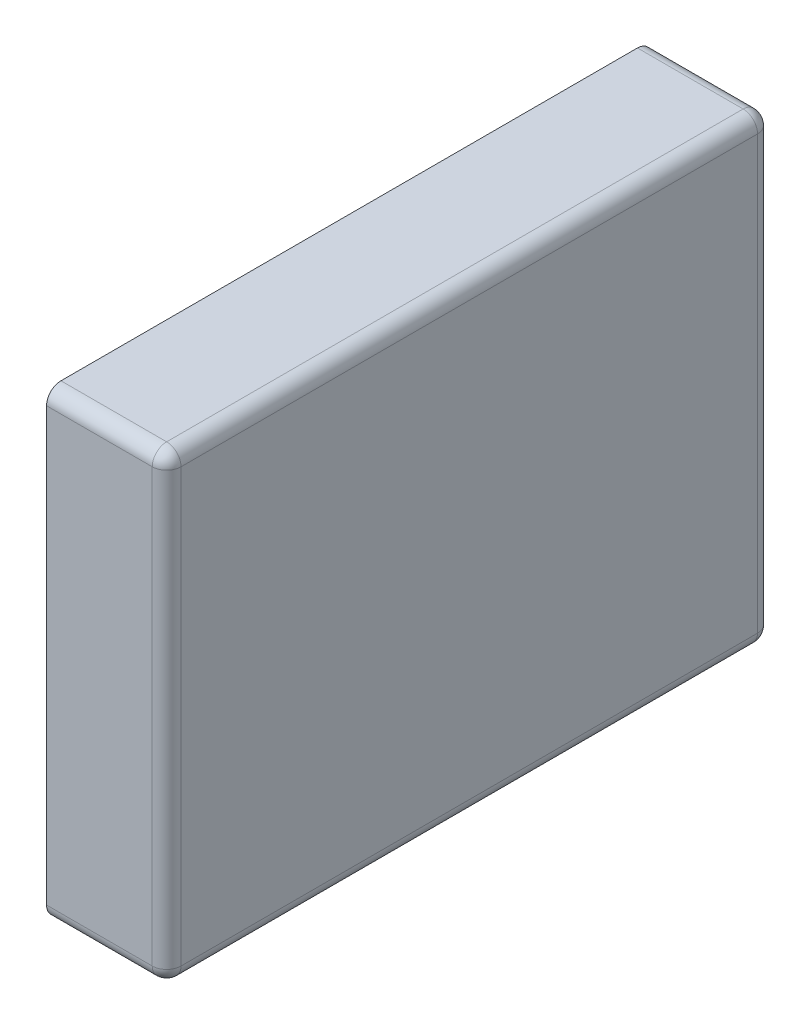
from build123d import *

# Parameters (mm, degrees)
SKETCH3_W           = 126
SKETCH3_H           = 96
BOSS_EXTRUDE3_DEPTH = 25
FILLET9_R           = 3
FILLET10_R          = 3
FILLET11_R          = 3
FILLET12_R          = 3
SKETCH5_W           = 124
SKETCH5_H           = 94
CUT_EXTRUDE4_DEPTH  = 1
SKETCH6_W           = 122
SKETCH6_H           = 92
CUT_EXTRUDE5_DEPTH  = 20
FILLET17_R          = 6
FILLET18_R          = 6
FILLET19_R          = 6
FILLET20_R          = 6
FILLET21_R          = 6
FILLET22_R          = 6
FILLET23_R          = 6
FILLET24_R          = 6


with BuildPart() as part:
    # Sketch3 → Boss-Extrude3 (new body)
    with BuildSketch(Plane(origin=(0, 0, 0), x_dir=(0, 0, -1), z_dir=(1, 0, 0))):
        Rectangle(SKETCH3_W, SKETCH3_H)
    extrude(amount=BOSS_EXTRUDE3_DEPTH)

    # Fillet9
    fillet9_edges = [part.edges().sort_by_distance(p)[0] for p in [
        (12.5, 48, 63),
    ]]
    fillet(fillet9_edges, radius=FILLET9_R)

    # Fillet10
    fillet10_edges = [part.edges().sort_by_distance(p)[0] for p in [
        (25, 48, -1.5),
        (25, 47.121320344, 62.121320344),
        (25, -1.5, 63),
    ]]
    fillet(fillet10_edges, radius=FILLET10_R)

    # Fillet11
    fillet11_edges = [part.edges().sort_by_distance(p)[0] for p in [
        (11, -48, 63),
        (24.121320344, -48, 62.121320344),
        (25, -48, -1.5),
    ]]
    fillet(fillet11_edges, radius=FILLET11_R)

    # Fillet12
    fillet12_edges = [part.edges().sort_by_distance(p)[0] for p in [
        (11, -48, -63),
        (24.121320344, -47.121320344, -63),
        (11, 48, -63),
        (24.121320344, 47.121320344, -63),
        (25, 0, -63),
    ]]
    fillet(fillet12_edges, radius=FILLET12_R)

    # Sketch5 → Cut-Extrude4 (cut)
    with BuildSketch(Plane.ZY):
        Rectangle(SKETCH5_W, SKETCH5_H)
    extrude(amount=-CUT_EXTRUDE4_DEPTH, mode=Mode.SUBTRACT)

    # Sketch6 → Cut-Extrude5 (cut)
    with BuildSketch(Plane.ZY.offset(-1)):
        Rectangle(SKETCH6_W, SKETCH6_H)
    extrude(amount=-CUT_EXTRUDE5_DEPTH, mode=Mode.SUBTRACT)

    # Fillet17
    fillet17_edges = [part.edges().sort_by_distance(p)[0] for p in [
        (11, 46, 61),
    ]]
    fillet(fillet17_edges, radius=FILLET17_R)

    # Fillet18
    fillet18_edges = [part.edges().sort_by_distance(p)[0] for p in [
        (0.5, 47, 62),
    ]]
    fillet(fillet18_edges, radius=FILLET18_R)

    # Fillet19
    fillet19_edges = [part.edges().sort_by_distance(p)[0] for p in [
        (11, 46, -61),
    ]]
    fillet(fillet19_edges, radius=FILLET19_R)

    # Fillet20
    fillet20_edges = [part.edges().sort_by_distance(p)[0] for p in [
        (0.5, 47, -62),
    ]]
    fillet(fillet20_edges, radius=FILLET20_R)

    # Fillet21
    fillet21_edges = [part.edges().sort_by_distance(p)[0] for p in [
        (11, -46, 61),
    ]]
    fillet(fillet21_edges, radius=FILLET21_R)

    # Fillet22
    fillet22_edges = [part.edges().sort_by_distance(p)[0] for p in [
        (0.5, -47, 62),
    ]]
    fillet(fillet22_edges, radius=FILLET22_R)

    # Fillet23
    fillet23_edges = [part.edges().sort_by_distance(p)[0] for p in [
        (11, -46, -61),
    ]]
    fillet(fillet23_edges, radius=FILLET23_R)

    # Fillet24
    fillet24_edges = [part.edges().sort_by_distance(p)[0] for p in [
        (0.5, -47, -62),
    ]]
    fillet(fillet24_edges, radius=FILLET24_R)


solid = part.part
